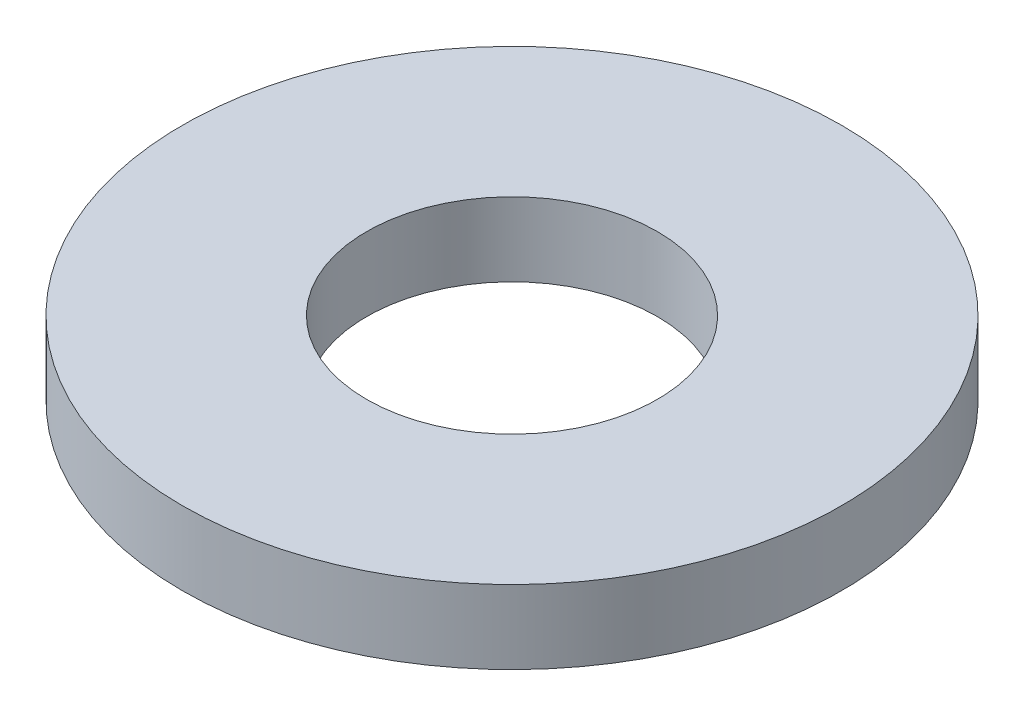
from build123d import *

# Parameters (mm, degrees)
SKETCH1_R           = 85
BOSS_EXTRUDE1_DEPTH = 19
SKETCH2_R           = 37.5
CUT_EXTRUDE1_DEPTH  = 122.70045193


with BuildPart() as part:
    # Sketch1 → Boss-Extrude1 (new body)
    with BuildSketch(Plane(origin=(0, 0, 0), x_dir=(1, 0, 0), z_dir=(0, 1, 0))):
        Circle(SKETCH1_R)
    extrude(amount=BOSS_EXTRUDE1_DEPTH)

    # Sketch2 → Cut-Extrude1 (cut, through all)
    with BuildSketch(Plane(origin=(0, 0, 0), x_dir=(1, 0, 0), z_dir=(0, 1, 0))):
        Circle(SKETCH2_R)
    extrude(amount=CUT_EXTRUDE1_DEPTH, mode=Mode.SUBTRACT)


solid = part.part
